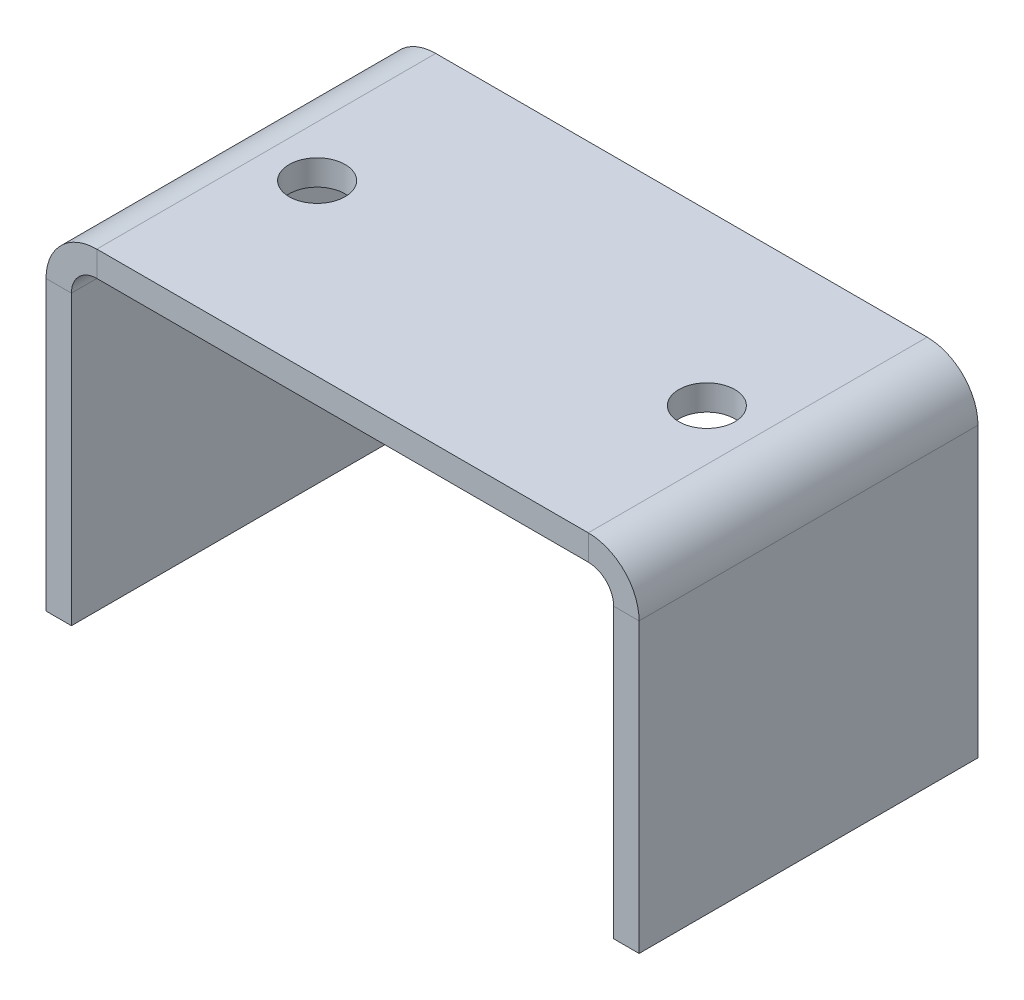
from build123d import *

# Parameters (mm, degrees)
SM_BASE_FLANGE_1_DEPTH  = 20
HOLE_WIZARD_6_6_6_6_1_D = 6.6


# Sheet-metal steps are written as plain solids
with BuildPart() as part:
    # Sketch 1 → Базовая кромка1 (new, symmetric)
    with BuildSketch(Plane.XY):
        with BuildLine():
            Line((0, 0), (0, 34))
            ThreePointArc((0, 34), (1.757359313, 38.242640687), (6, 40))
            Line((6, 40), (64, 40))
            ThreePointArc((64, 40), (68.242640687, 38.242640687), (70, 34))
            Line((70, 34), (70, 0))
            Line((70, 0), (67, 0))
            Line((67, 0), (67, 34))
            ThreePointArc((67, 34), (66.121320344, 36.121320344), (64, 37))
            Line((64, 37), (6, 37))
            ThreePointArc((6, 37), (3.878679656, 36.121320344), (3, 34))
            Line((3, 34), (3, 0))
            Line((3, 0), (0, 0))
        make_face()
    extrude(amount=SM_BASE_FLANGE_1_DEPTH, both=True)

    # Диаметр отверстия Ø6.6 (6.6)1 (through all)
    with Locations(Plane(origin=(0, 40, 0), x_dir=(1, 0, 0), z_dir=(0, 1, 0))):
        with Locations((12, 0), (58, 0)):
            Hole(HOLE_WIZARD_6_6_6_6_1_D / 2)


solid = part.part
